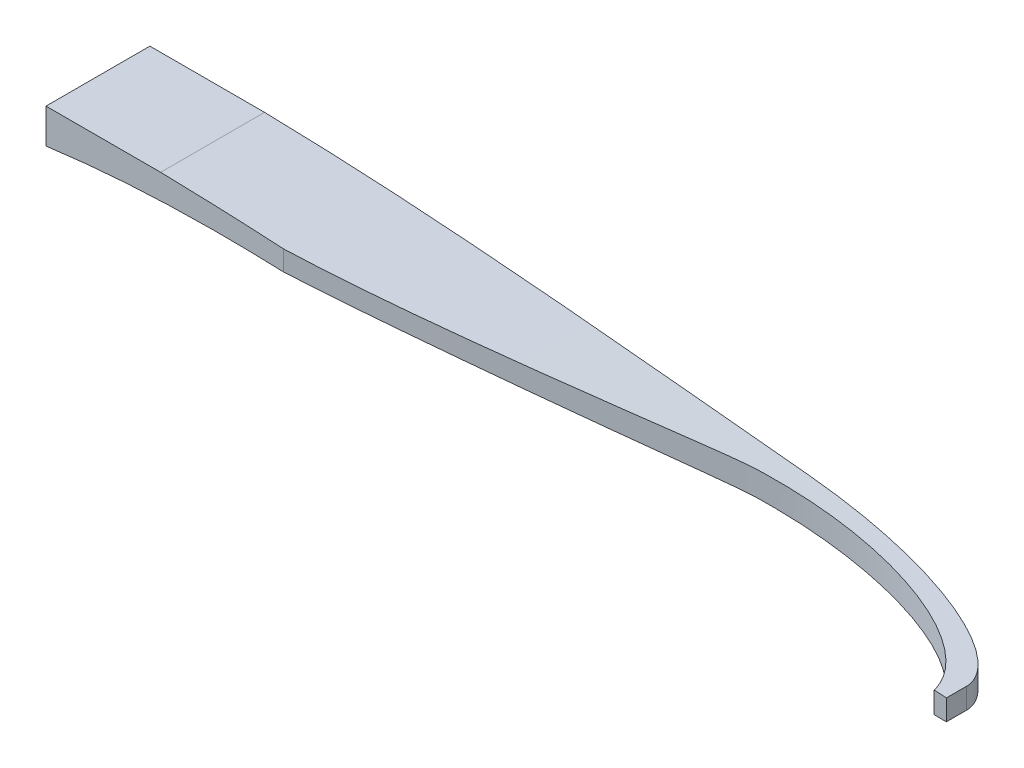
from build123d import *

# Parameters (mm, degrees)
SKETCH1_W           = 165.1
SKETCH1_H           = 19.05
BOSS_EXTRUDE1_DEPTH = 15.24
CUT_EXTRUDE1_DEPTH  = 167.892690373
CUT_EXTRUDE2_DEPTH  = 19.05


with BuildPart() as part:
    # Sketch1 → Boss-Extrude1 (new body)
    with BuildSketch(Plane(origin=(0, 0, 0), x_dir=(1, 0, 0), z_dir=(0, 1, 0))):
        with Locations((82.55, 9.525)):
            Rectangle(SKETCH1_W, SKETCH1_H)
    extrude(amount=BOSS_EXTRUDE1_DEPTH)

    # Sketch3 → Cut-Extrude1 (cut, through all)
    with BuildSketch(Plane(origin=(0, 0, -19.05), x_dir=(-1, 0, 0), z_dir=(0, 0, -1))):
        with BuildLine():
            Line((0, 0), (0, 8.89))
            add(Edge.make_bspline(
                [(0, 8.89), (-55.610465867, 16.424996391), (-109.802345205, 0.466619186), (-165.1, 0)],
                knots=[0, 0, 0, 0, 1, 1, 1, 1], degree=3))
            Line((-165.1, 0), (0, 0))
        make_face()
        with BuildLine():
            Line((-165.1, 15.24), (-165.1, 3.81))
            add(Edge.make_bspline(
                [(-21.030627916, 15.24), (-69.234524969, 14.234664712), (-117.008779992, 6.828893734), (-165.1, 3.81)],
                knots=[0.126808745, 0.126808745, 0.126808745, 0.126808745, 1, 1, 1, 1], degree=3))
            Line((-21.030627916, 15.24), (-165.1, 15.24))
        make_face()
    extrude(amount=-CUT_EXTRUDE1_DEPTH, mode=Mode.SUBTRACT)

    # Sketch4 → Cut-Extrude2 (cut)
    with BuildSketch(Plane(origin=(0, 15.24, 0), x_dir=(1, 0, 0), z_dir=(0, 1, 0))):
        with BuildLine():
            add(Edge.make_bspline(
                [(34.297465122, -0.499669152), (60.105747285, -0.275652974), (108.357196565, 13.760299467), (117.328544226, 14.915248428), (141.374051361, 17.349751742), (161.282563375, 9.159827242), (162.9821082, -0.499669152)],
                knots=[0.004161352, 0.004161352, 0.004161352, 0.004161352, 0.232814945, 0.263032562, 0.297826877, 1, 1, 1, 1], degree=3))
            Line((34.297465122, -0.499669152), (162.9821082, -0.499669152))
        make_face()
        with BuildLine():
            add(Edge.make_bspline(
                [(120.855562162, 19.05), (147.394709071, 18.966566843), (165.097984543, 10.483080648), (165.1, 3.658781514)],
                knots=[0, 0, 0, 0, 1, 1, 1, 1], degree=3))
            Line((165.1, 3.658781514), (165.1, 19.05))
            Line((165.1, 19.05), (120.855562162, 19.05))
        make_face()
    extrude(amount=-CUT_EXTRUDE2_DEPTH, mode=Mode.SUBTRACT)


solid = part.part
